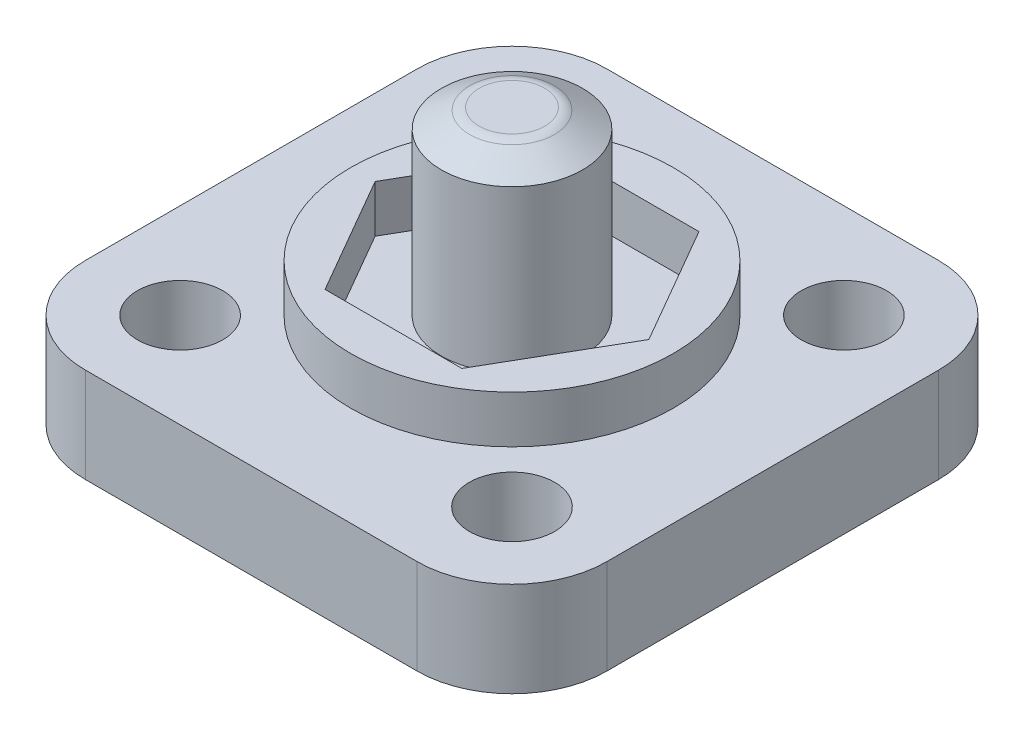
from build123d import *

# Parameters (mm, degrees)
BOSS_EXTRUDE1_DEPTH                        = 10
SKETCH3_R                                  = 4.5
CUT_EXTRUDE1_DEPTH                         = 44.283946216
MIRROR1_AT_THE_SECOND_PLANE_COPY_1_SKETC_R = 4.5
MIRROR1_AT_THE_SECOND_PLANE_COPY_1_DEPTH   = 44.283946216
CUT_EXTRUDE3_START                         = -5
SKETCH4_R                                  = 7.45
CUT_EXTRUDE3_DEPTH                         = 5


with BuildPart() as part:
    # Sketch1 → Revolve1 (revolve)
    with BuildSketch(Plane.XY):
        with BuildLine():
            Line((0, 9.5), (3.462206124, 9.5))
            ThreePointArc((3.462206124, 9.5), (3.981551863, 9.43139328), (4.465266995, 9.230280003))
            Line((4.465266995, 9.230280003), (7.45, 7.5))
            Line((7.45, 7.5), (7.45, -4.5))
            Line((7.45, -4.5), (17, -4.5))
            Line((17, -4.5), (17, -9.5))
            Line((17, -9.5), (7.45, -9.5))
            Line((7.45, -9.5), (0, -9.5))
            Line((0, -9.5), (0, 9.5))
        make_face()
    revolve(axis=Axis((0, 9.5, 0), (0, -1, 0)))

    # Sketch2 → Boss-Extrude1 (add)
    with BuildSketch(Plane.XZ.offset(9.5)):
        with BuildLine():
            Line((17.5, 27.5), (-17.5, 27.5))
            ThreePointArc((-17.5, 27.5), (-24.571067812, 24.571067812), (-27.5, 17.5))
            Line((-27.5, 17.5), (-27.5, -17.5))
            ThreePointArc((-27.5, -17.5), (-24.571067812, -24.571067812), (-17.5, -27.5))
            Line((-17.5, -27.5), (17.5, -27.5))
            ThreePointArc((17.5, -27.5), (24.571067812, -24.571067812), (27.5, -17.5))
            Line((27.5, -17.5), (27.5, 17.5))
            ThreePointArc((27.5, 17.5), (24.571067812, 24.571067812), (17.5, 27.5))
        make_face()
    extrude(amount=BOSS_EXTRUDE1_DEPTH)

    # Sketch3 → Cut-Extrude1 (cut, through all)
    with BuildSketch(Plane(origin=(0, -9.5, 0), x_dir=(1, 0, 0), z_dir=(0, 1, 0))):
        with Locations((-17.5, 17.5)):
            Circle(SKETCH3_R)
    cut_extrude1 = extrude(amount=-CUT_EXTRUDE1_DEPTH, mode=Mode.SUBTRACT)

    # Mirror1: Cut-Extrude1 across plane
    add(cut_extrude1.mirror(Plane.XY), mode=Mode.SUBTRACT)

    # Mirror1 at the second plane: Cut-Extrude1 across plane
    add(cut_extrude1.mirror(Plane(origin=(0, 0, 0), x_dir=(0, 0, 1), z_dir=(1, 0, 0))), mode=Mode.SUBTRACT)

    # Mirror1 at the second plane copy 1 sketc → Mirror1 at the second plane copy 1 (cut, through all)
    with BuildSketch(Plane(origin=(0, -9.5, 0), x_dir=(-1, 0, 0), z_dir=(0, 1, 0))):
        with Locations((-17.5, 17.5)):
            Circle(MIRROR1_AT_THE_SECOND_PLANE_COPY_1_SKETC_R)
    extrude(amount=-MIRROR1_AT_THE_SECOND_PLANE_COPY_1_DEPTH, mode=Mode.SUBTRACT)

    # Sketch4 → Cut-Extrude3 (cut)
    with BuildSketch(Plane(origin=(0, -4.5, 0), x_dir=(1, 0, 0), z_dir=(0, 1, 0)).offset(CUT_EXTRUDE3_START)):
        Polygon((14.43375673, 0), (7.216878365, 12.5), (-7.216878365, 12.5), (-14.43375673, 0), (-7.216878365, -12.5), (7.216878365, -12.5), align=None)
        Circle(SKETCH4_R, mode=Mode.SUBTRACT)
    extrude(amount=CUT_EXTRUDE3_DEPTH, mode=Mode.SUBTRACT)


solid = part.part
